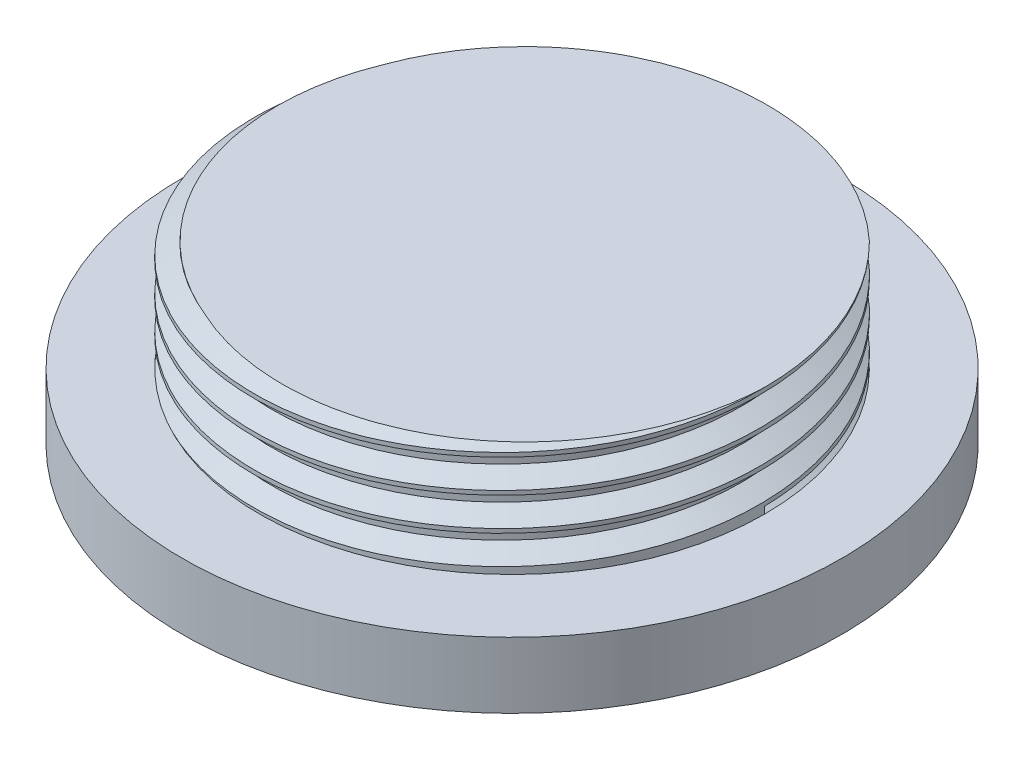
from build123d import *

# Parameters (mm, degrees)
ROSCA1_PITCH            = 1.5
SALIENTE_EXTRUIR1_DEPTH = 2


with BuildPart() as part:
    # Croquis1 → Revolución1 (revolve)
    with BuildSketch(Plane.XY, mode=Mode.PRIVATE) as revoluci_n1_sk:
        Polygon((0, 0), (-11.5, 0), (-11.5, -5), (-15, -5), (-15, -8), (0, -8), align=None)
    revolve(revoluci_n1_sk.sketch.rotate(Axis((0, -8, 0), (0, 1, 0)), 270), axis=Axis((0, -8, 0), (0, 1, 0)))

    # Rosca1: arcs per turn and ends read off the stored shape
    # Rosca1: the profile of Perfil de rosca1 profile screwed along a right-hand helix through 4 turns, 8 arcs to a turn; built about Z, then put on its axis
    rosca1_z = Axis((0, 0, 0), (0, 0, 1))
    rosca1_corners = [(11.5003, 0, -6.000173205), (11.5003, 0, -4.687326799), (10.688101187, 0, -5.156250002), (10.688101187, 0, -5.531250002)]
    with BuildLine(mode=Mode.PRIVATE) as rosca1_profile:
        Line(rosca1_corners[0], rosca1_corners[1])
        Line(rosca1_corners[1], rosca1_corners[2])
        Line(rosca1_corners[2], rosca1_corners[3])
        Line(rosca1_corners[3], rosca1_corners[0])
    rosca1_cap = Face(rosca1_profile.wire())
    rosca1_turn_angles = [0, 22.5, 45, 67.5, 90, 112.5, 135, 157.5, 180, 202.5, 225, 247.5, 270, 292.5, 315, 337.5, 360]
    rosca1_turn_weights = [1, 0.9238795325112867, 1, 0.9238795325112867, 1, 0.9238795325112867, 1, 0.9238795325112867, 1, 0.9238795325112867, 1, 0.9238795325112867, 1, 0.9238795325112867, 1, 0.9238795325112867, 1]
    rosca1_turn_rails = [Edge.make_bspline([Vector(p[0], p[1], 0).rotate(rosca1_z, rosca1_turn_angles[k]) / rosca1_turn_weights[k] + Vector(0, 0, p[2] + ROSCA1_PITCH * rosca1_turn_angles[k] / 360) for k in range(17)], [0, 0, 0, 1, 1, 2, 2, 3, 3, 4, 4, 5, 5, 6, 6, 7, 7, 8, 8, 8], 2, rosca1_turn_weights) for p in rosca1_corners]
    rosca1_turn_sides = [Face.make_surface_from_curves(rosca1_turn_rails[p[0]], rosca1_turn_rails[p[1]]) for p in [(0, 1), (1, 2), (2, 3), (3, 0)]]
    rosca1 = Plane(origin=(0, 0, 0), x_dir=(1, 0, 0), z_dir=(0, 1, 0)) * Solid(Shell([*[p.moved(Location((0, 0, ROSCA1_PITCH * i))) for i in range(4) for p in rosca1_turn_sides], rosca1_cap, rosca1_cap.rotate(rosca1_z, 1440).moved(Location((0, 0, ROSCA1_PITCH * 1440 / 360)))]))
    add(rosca1, mode=Mode.SUBTRACT)

    # Croquis4 → Saliente-Extruir1 (add)
    # profile 1 of 3: a face of its own
    with BuildSketch(Plane.XZ.offset(8)):
        with BuildLine():
            add(Edge.make_bspline(
                [(5.478251921, -3.002627178), (5.29390043, -3.099654278), (4.905928354, -2.884281882), (4.501376727, -2.785808896), (4.196909906, -2.677109789), (3.967746952, -2.596816805), (3.760339535, -2.582999575), (3.585993776, -2.579520243), (3.441930866, -2.749462512), (2.780665747, -3.174491487), (0.84891506, -3.958631309), (-1.731438128, -3.299476192), (-3.14295018, -1.604521485), (-4.120441453, 0.120175448), (-4.806778409, 1.614644178), (-5.299672689, 2.581173013)],
                knots=[0, 0, 0, 0, 0.045509031, 0.074889424, 0.092461381, 0.113663555, 0.12569481, 0.137175213, 0.14804311, 0.170270934, 0.305000949, 0.581101451, 0.650983707, 0.770099509, 1, 1, 1, 1], degree=3))
            add(Edge.make_bspline(
                [(-5.299672689, 2.581173013), (-4.615732768, 2.716237164), (-3.265011851, 2.754011185), (-0.530490799, 2.720991239), (2.287611791, 1.54730746), (3.68359082, -0.65985297), (4.027793562, -1.719144185), (3.897343367, -2.24708248), (4.101924802, -2.302858997), (4.282500388, -2.386476967), (4.559218265, -2.475648125), (4.9566792, -2.617478505), (5.50575564, -2.704670228), (5.478251921, -3.002627178)],
                knots=[0, 0, 0, 0, 0.154784951, 0.300688181, 0.611266062, 0.783841375, 0.856255033, 0.872092857, 0.881127578, 0.897547223, 0.918952342, 0.943746115, 1, 1, 1, 1], degree=3))
        make_face()
        with BuildLine():
            Line((3.501943469, -1.963738888), (2.806699504, -1.746883796))
            add(Edge.make_bspline(
                [(2.758751644, 0.063147905), (2.711784764, -0.260993476), (2.788194051, -0.863427479), (2.764738323, -1.46857617), (2.806699504, -1.746883796)],
                knots=[0, 0, 0, 0, 0.536589435, 1, 1, 1, 1], degree=3))
            add(Edge.make_bspline(
                [(3.501943469, -1.963738888), (3.544770354, -1.67402202), (3.479047395, -1.233849135), (3.167578768, -0.565338884), (2.926648789, -0.190216633), (2.758751644, 0.063147905)],
                knots=[0, 0, 0, 0, 0.395874286, 0.586576357, 1, 1, 1, 1], degree=3))
        make_face(mode=Mode.SUBTRACT)
        with BuildLine():
            add(Edge.make_bspline(
                [(3.197402382, -2.435214612), (2.968736749, -2.704477653), (2.311957293, -3.001367046), (1.637294996, -3.249592229), (1.259577413, -3.236522878)],
                knots=[0, 0, 0, 0, 0.481114359, 1, 1, 1, 1], degree=3))
            add(Edge.make_bspline(
                [(2.792667099, -2.254640409), (2.624098806, -2.349703444), (2.385622108, -2.536713617), (1.849963251, -2.825258305), (1.469683649, -3.004839382), (1.259577413, -3.236522878)],
                knots=[0, 0, 0, 0, 0.317739101, 0.494985422, 1, 1, 1, 1], degree=3))
            Line((2.792667099, -2.254640409), (3.197402382, -2.435214612))
        make_face(mode=Mode.SUBTRACT)
        with BuildLine():
            add(Edge.make_bspline(
                [(2.332625336, -2.057359371), (2.204444092, -2.237750259), (1.908981692, -2.419240301), (1.501054271, -2.70593187), (1.075563329, -2.900327886), (0.830287167, -3.135814987), (0.657435515, -3.20047928)],
                knots=[0, 0, 0, 0, 0.316444487, 0.507915907, 0.734242178, 1, 1, 1, 1], degree=3))
            add(Edge.make_bspline(
                [(0.657435515, -3.20047928), (0.275019141, -3.281893265), (-0.122446389, -3.21645441), (-0.487956601, -3.094647063)],
                knots=[0, 0, 0, 0, 1, 1, 1, 1], degree=3))
            add(Edge.make_bspline(
                [(-0.487956601, -3.094647063), (-0.311841775, -2.909420999), (0.012112243, -2.655680867), (0.488030817, -2.329600161), (0.931290816, -2.044883182), (1.21680585, -1.805420721), (1.393575168, -1.702159119)],
                knots=[0, 0, 0, 0, 0.326234019, 0.524999997, 0.738479425, 1, 1, 1, 1], degree=3))
            add(Edge.make_bspline(
                [(2.332625336, -2.057359371), (2.171179591, -2.016939858), (1.861263246, -1.889311075), (1.552649438, -1.759644974), (1.393575168, -1.702159119)],
                knots=[0, 0, 0, 0, 0.495129296, 1, 1, 1, 1], degree=3))
        make_face(mode=Mode.SUBTRACT)
        with BuildLine():
            add(Edge.make_bspline(
                [(2.446306348, -1.467932866), (2.160175002, -1.385822633), (1.885149078, -1.269932675), (1.614931846, -1.146193508)],
                knots=[0, 0, 0, 0, 1, 1, 1, 1], degree=3))
            add(Edge.make_bspline(
                [(1.614931846, -1.146193508), (1.621068886, -0.820351844), (1.484452096, -0.314447891), (1.441131257, 0.480823724), (1.380601066, 0.950318327), (1.393575168, 1.226956)],
                knots=[0, 0, 0, 0, 0.405945984, 0.652935856, 1, 1, 1, 1], degree=3))
            add(Edge.make_bspline(
                [(2.332625336, 0.372416264), (2.293992565, 0.553201885), (2.091301766, 0.742095018), (1.793348205, 1.066435187), (1.531018304, 1.147424255), (1.393575168, 1.226956)],
                knots=[0, 0, 0, 0, 0.397172812, 0.631474775, 1, 1, 1, 1], degree=3))
            add(Edge.make_bspline(
                [(2.446306348, -1.467932866), (2.42971673, -1.196917742), (2.400748601, -0.582959081), (2.363711139, 0.030640418), (2.332625336, 0.372416264)],
                knots=[0, 0, 0, 0, 0.44173337, 1, 1, 1, 1], degree=3))
        make_face(mode=Mode.SUBTRACT)
        with BuildLine():
            add(Edge.make_bspline(
                [(0.894235683, -1.467932866), (0.693700668, -1.625183301), (0.352182984, -1.879664067), (-0.072199287, -2.246390825), (-0.521686018, -2.488609457), (-0.7478475, -2.745156951), (-0.916112577, -2.857973234)],
                knots=[0, 0, 0, 0, 0.33454946, 0.559859208, 0.734193862, 1, 1, 1, 1], degree=3))
            add(Edge.make_bspline(
                [(-0.916112577, -2.857973234), (-1.139922913, -2.847400378), (-1.425096366, -2.606537003), (-1.763759615, -2.455542177), (-1.873559432, -2.337916092)],
                knots=[0, 0, 0, 0, 0.568617713, 1, 1, 1, 1], degree=3))
            add(Edge.make_bspline(
                [(-1.873559432, -2.337916092), (-1.703076272, -2.169648407), (-1.20044956, -1.613342955), (-0.553071122, -1.216932424), (-0.208391607, -0.842711136)],
                knots=[0, 0, 0, 0, 0.321357801, 1, 1, 1, 1], degree=3))
            add(Edge.make_bspline(
                [(0.894235683, -1.467932866), (0.716233223, -1.36438606), (0.30372745, -1.237101052), (-0.023137138, -0.954404207), (-0.208391607, -0.842711136)],
                knots=[0, 0, 0, 0, 0.486655124, 1, 1, 1, 1], degree=3))
        make_face(mode=Mode.SUBTRACT)
        with BuildLine():
            add(Edge.make_bspline(
                [(-0.736608479, -0.612512132), (-0.83737925, -0.8429299), (-1.142908694, -1.093011337), (-1.704085469, -1.501329446), (-1.937074732, -1.906326717), (-2.2092938, -2.057359371)],
                knots=[0, 0, 0, 0, 0.35060217, 0.56402103, 1, 1, 1, 1], degree=3))
            add(Edge.make_bspline(
                [(-2.2092938, -2.057359371), (-2.412845621, -1.924711374), (-2.608290812, -1.539268727), (-2.906394563, -1.232926401), (-3.006998349, -1.068531412)],
                knots=[0, 0, 0, 0, 0.548238925, 1, 1, 1, 1], degree=3))
            add(Edge.make_bspline(
                [(-3.006998349, -1.068531412), (-2.776596409, -0.921205781), (-2.453035519, -0.713833474), (-1.997445907, -0.366536647), (-1.725699875, -0.230938058), (-1.595674916, -0.090888412)],
                knots=[0, 0, 0, 0, 0.477747976, 0.669719662, 1, 1, 1, 1], degree=3))
            add(Edge.make_bspline(
                [(-0.736608479, -0.612512132), (-0.998680748, -0.395875208), (-1.349073817, -0.329301695), (-1.595674916, -0.090888412)],
                knots=[0, 0, 0, 0, 1, 1, 1, 1], degree=3))
        make_face(mode=Mode.SUBTRACT)
        with BuildLine():
            add(Edge.make_bspline(
                [(-3.194809653, -0.751762071), (-2.965312201, -0.52626626), (-2.521872548, -0.351028703), (-2.083739495, -0.043196962), (-2.021812124, 0.140440683)],
                knots=[0, 0, 0, 0, 0.616736789, 1, 1, 1, 1], degree=3))
            add(Edge.make_bspline(
                [(-2.021812124, 0.140440683), (-2.350408456, 0.458763469), (-2.823922379, 0.540185753), (-3.144991226, 0.869169882)],
                knots=[0, 0, 0, 0, 1, 1, 1, 1], degree=3))
            add(Edge.make_bspline(
                [(-3.8786808, 0.498227574), (-3.59028248, 0.523038175), (-3.450031178, 0.943460313), (-3.144991226, 0.869169882)],
                knots=[0, 0, 0, 0, 1, 1, 1, 1], degree=3))
            add(Edge.make_bspline(
                [(-3.194809653, -0.751762071), (-3.387908289, -0.532806012), (-3.515070983, -0.063874745), (-3.791986348, 0.32769372), (-3.8786808, 0.498227574)],
                knots=[0, 0, 0, 0, 0.597561688, 1, 1, 1, 1], degree=3))
        make_face(mode=Mode.SUBTRACT)
        with BuildLine():
            add(Edge.make_bspline(
                [(-3.548067597, 1.147164639), (-3.643824206, 1.109802317), (-3.925940599, 0.726353745), (-4.167660365, 1.012591638), (-4.332048959, 1.370797362), (-4.510588136, 1.696099048), (-4.630486166, 1.924846191)],
                knots=[0, 0, 0, 0, 0.310867916, 0.394957503, 0.558356504, 1, 1, 1, 1], degree=3))
            add(Edge.make_bspline(
                [(-3.548067597, 1.147164639), (-3.697235715, 1.287648094), (-4.047670084, 1.562171511), (-4.400928694, 1.839442536), (-4.630486166, 1.924846191)],
                knots=[0, 0, 0, 0, 0.458358468, 1, 1, 1, 1], degree=3))
        make_face(mode=Mode.SUBTRACT)
        with BuildLine():
            add(Edge.make_bspline(
                [(-3.457488637, 1.698398791), (-3.444614185, 1.869649804), (-3.467543771, 2.038666228), (-3.448019918, 2.387247155), (-3.652377855, 2.38184248), (-3.828843876, 2.423075618), (-4.150172475, 2.386788056), (-4.392526111, 2.473823769), (-4.562551946, 2.418501521)],
                knots=[0, 0, 0, 0, 0.268264531, 0.385213078, 0.459278609, 0.566833805, 0.712658108, 1, 1, 1, 1], degree=3))
            add(Edge.make_bspline(
                [(-3.457488637, 1.698398791), (-3.662587569, 1.821728169), (-4.043372356, 2.044851742), (-4.380401593, 2.330688851), (-4.562551946, 2.418501521)],
                knots=[0, 0, 0, 0, 0.544609427, 1, 1, 1, 1], degree=3))
        make_face(mode=Mode.SUBTRACT)
        with BuildLine():
            add(Edge.make_bspline(
                [(-1.907130483, 0.709290217), (-2.136760904, 0.783369598), (-2.37607623, 1.040076469), (-2.814646657, 1.169325129), (-2.957256222, 1.473391315), (-3.018250983, 1.858057874), (-3.061615005, 2.172816098), (-3.061633453, 2.364154146)],
                knots=[0, 0, 0, 0, 0.312979463, 0.470055147, 0.574113789, 0.74198976, 1, 1, 1, 1], degree=3))
            add(Edge.make_bspline(
                [(-1.907130483, 0.709290217), (-2.002273826, 0.979492376), (-1.956855694, 1.376213483), (-2.108774276, 1.859666668), (-2.201904226, 2.104198645), (-2.244093622, 2.336876129), (-2.590704454, 2.407308877), (-2.826026799, 2.328087179), (-3.061633453, 2.364154146)],
                knots=[0, 0, 0, 0, 0.341457352, 0.475560879, 0.607155055, 0.678259428, 0.727850671, 1, 1, 1, 1], degree=3))
        make_face(mode=Mode.SUBTRACT)
        with BuildLine():
            add(Edge.make_bspline(
                [(-0.674888062, 0), (-0.85732761, 0.09940098), (-1.099407772, 0.203756829), (-1.38895256, 0.400738698), (-1.524316253, 0.672267206), (-1.613018828, 1.035791762), (-1.599284284, 1.614779227), (-1.827175427, 1.993900555), (-1.827974048, 2.273575186)],
                knots=[0, 0, 0, 0, 0.225465408, 0.29156805, 0.375328035, 0.547817357, 0.698545178, 1, 1, 1, 1], degree=3))
            add(Edge.make_bspline(
                [(-0.674888062, 0), (-0.675799539, 0.274855721), (-0.846109586, 0.667111782), (-0.865488367, 1.215453568), (-0.955115287, 1.620633189), (-0.995526171, 1.917587682), (-1.025186834, 2.21424959), (-1.412312681, 2.233997717), (-1.61491931, 2.313651929), (-1.827974048, 2.273575186)],
                knots=[0, 0, 0, 0, 0.271622479, 0.416102507, 0.548394434, 0.680552673, 0.734695834, 0.811446838, 1, 1, 1, 1], degree=3))
        make_face(mode=Mode.SUBTRACT)
        with BuildLine():
            add(Edge.make_bspline(
                [(1.113018447, -0.842711136), (0.902986366, -0.771299419), (0.545542086, -0.681466915), (0.162774294, -0.410413541), (-0.161026202, -0.321463945), (-0.340732039, 0.032997421), (-0.327758733, 0.475783289), (-0.511246011, 1.163479188), (-0.470819364, 1.681880904), (-0.570823542, 2.008649708)],
                knots=[0, 0, 0, 0, 0.180624549, 0.286973248, 0.379070055, 0.431350089, 0.590975992, 0.729093622, 1, 1, 1, 1], degree=3))
            add(Edge.make_bspline(
                [(1.113018447, -0.842711136), (1.125220159, -0.559408194), (1.07116388, -0.116672573), (1.019250714, 0.53792248), (0.905013545, 1.021884086), (0.992410032, 1.508684179), (0.68271966, 1.695417146), (0.396403919, 1.804163172), (-0.049296099, 1.896509595), (-0.352746042, 2.061695928), (-0.570823542, 2.008649708)],
                knots=[0, 0, 0, 0, 0.213489292, 0.340134324, 0.492638803, 0.605070801, 0.657073496, 0.74688571, 0.84183989, 1, 1, 1, 1], degree=3))
        make_face(mode=Mode.SUBTRACT)
    # profile 2 of 3: a face of its own
    with BuildSketch(Plane.XZ.offset(8)):
        Polygon((4.345748114, -0.974781748), (6.452582237, -0.974781748), (6.452582237, 0.181006336), (6.749223114, 0.181006336), (6.749223114, -1.475309798), (4.345748114, -1.475309798), align=None)
    # profile 3 of 3: a face of its own
    with BuildSketch(Plane.XZ.offset(8)):
        Polygon((4.345748114, 0.994845284), (6.452582237, 0.994845284), (6.452582237, 2.150633368), (6.749223114, 2.150633368), (6.749223114, 0.494317234), (4.345748114, 0.494317234), align=None)
    extrude(amount=SALIENTE_EXTRUIR1_DEPTH)


solid = part.part
